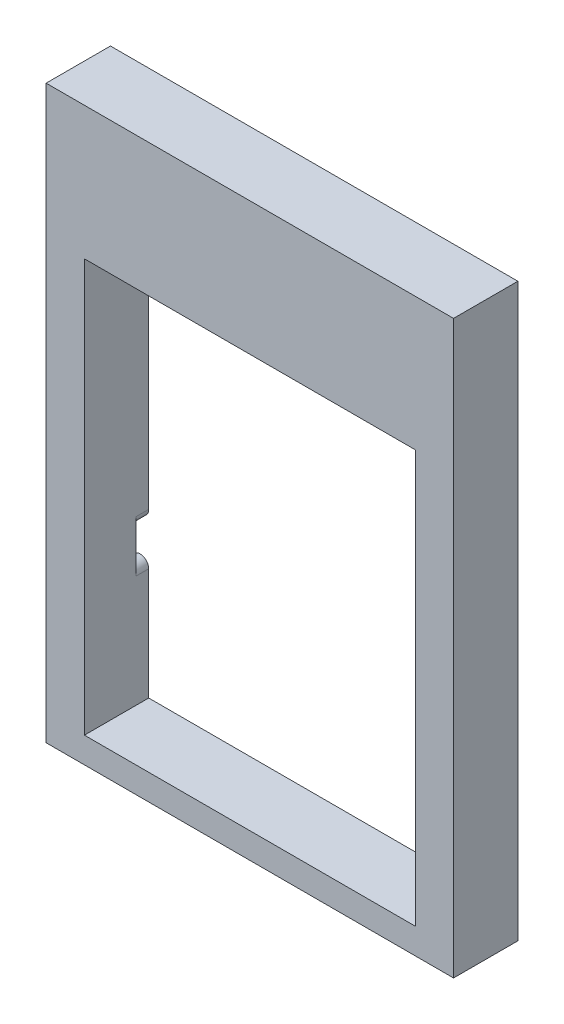
from build123d import *

# Parameters (mm, degrees)
MODEL_W             = 77.14935
MODEL_H             = 96.19946
EXTRUDE_1_DEPTH     = 15
CUT_EXTRUDE_1_DEPTH = 3


with BuildPart() as part:
    # Model → 凸台-拉伸1 (new body)
    with BuildSketch(Plane.XY):
        Polygon((187.809527429, 124.984602236), (93.660177429, 124.984602236), (93.234852429, 124.984602236), (93.234852429, -8.214857764), (96.160177429, -8.214857764), (185.309527429, -8.214857764), (188.234852429, -8.214857764), (188.234852429, 124.984602236), align=None)
        with Locations((140.734852429, 45.884872236)):
            Rectangle(MODEL_W, MODEL_H, mode=Mode.SUBTRACT)
    extrude(amount=EXTRUDE_1_DEPTH)

    # 草图1 → 切除-拉伸1 (cut)
    with BuildSketch(Plane(origin=(0, 0, 0), x_dir=(-1, 0, 0), z_dir=(0, 0, -1))):
        with BuildLine():
            Line((-185.309527429, 97.384872236), (-185.309527429, 79.384872236))
            ThreePointArc((-185.309527429, 79.384872236), (-184.309527429, 78.384872236), (-183.309527429, 79.384872236))
            Line((-183.309527429, 79.384872236), (-183.309527429, 82.384872236))
            ThreePointArc((-183.309527429, 82.384872236), (-181.309527429, 84.384872236), (-179.309527429, 82.384872236))
            Line((-179.309527429, 82.384872236), (-179.309527429, 35.884872236))
            ThreePointArc((-179.309527429, 35.884872236), (-181.309527429, 33.884872236), (-183.309527429, 35.884872236))
            Line((-183.309527429, 35.884872236), (-183.309527429, 38.884872236))
            ThreePointArc((-183.309527429, 38.884872236), (-184.309527429, 39.884872236), (-185.309527429, 38.884872236))
            Line((-185.309527429, 38.884872236), (-185.309527429, 20.884872236))
            ThreePointArc((-185.309527429, 20.884872236), (-184.309527429, 19.884872236), (-183.309527429, 20.884872236))
            Line((-183.309527429, 20.884872236), (-183.309527429, 23.884872236))
            ThreePointArc((-183.309527429, 23.884872236), (-181.309527429, 25.884872236), (-179.309527429, 23.884872236))
            Line((-179.309527429, 23.884872236), (-179.309527429, -1.999889741))
            Line((-179.309527429, -1.999889741), (-102.160177429, -1.999889741))
            Line((-102.160177429, -1.999889741), (-102.160177429, 23.884872236))
            ThreePointArc((-102.160177429, 23.884872236), (-100.160177429, 25.884872236), (-98.160177429, 23.884872236))
            Line((-98.160177429, 23.884872236), (-98.160177429, 20.884872236))
            ThreePointArc((-98.160177429, 20.884872236), (-97.160177429, 19.884872236), (-96.160177429, 20.884872236))
            Line((-96.160177429, 20.884872236), (-96.160177429, 38.884872236))
            ThreePointArc((-96.160177429, 38.884872236), (-97.160177429, 39.884872236), (-98.160177429, 38.884872236))
            Line((-98.160177429, 38.884872236), (-98.160177429, 35.884872236))
            ThreePointArc((-98.160177429, 35.884872236), (-100.160177429, 33.884872236), (-102.160177429, 35.884872236))
            Line((-102.160177429, 35.884872236), (-102.160177429, 82.384872236))
            ThreePointArc((-102.160177429, 82.384872236), (-100.160177429, 84.384872236), (-98.160177429, 82.384872236))
            Line((-98.160177429, 82.384872236), (-98.160177429, 79.384872236))
            ThreePointArc((-98.160177429, 79.384872236), (-97.160177429, 78.384872236), (-96.160177429, 79.384872236))
            Line((-96.160177429, 79.384872236), (-96.160177429, 97.384872236))
            ThreePointArc((-96.160177429, 97.384872236), (-97.160177429, 98.384872236), (-98.160177429, 97.384872236))
            Line((-98.160177429, 97.384872236), (-98.160177429, 94.384872236))
            ThreePointArc((-98.160177429, 94.384872236), (-100.160177429, 92.384872236), (-102.160177429, 94.384872236))
            Line((-102.160177429, 94.384872236), (-102.160177429, 118.984602236))
            Line((-102.160177429, 118.984602236), (-179.309527429, 118.984602236))
            Line((-179.309527429, 118.984602236), (-179.309527429, 94.384872236))
            ThreePointArc((-179.309527429, 94.384872236), (-181.309527429, 92.384872236), (-183.309527429, 94.384872236))
            Line((-183.309527429, 94.384872236), (-183.309527429, 97.384872236))
            ThreePointArc((-183.309527429, 97.384872236), (-184.309527429, 98.384872236), (-185.309527429, 97.384872236))
        make_face()
    extrude(amount=-CUT_EXTRUDE_1_DEPTH, mode=Mode.SUBTRACT)


solid = part.part
